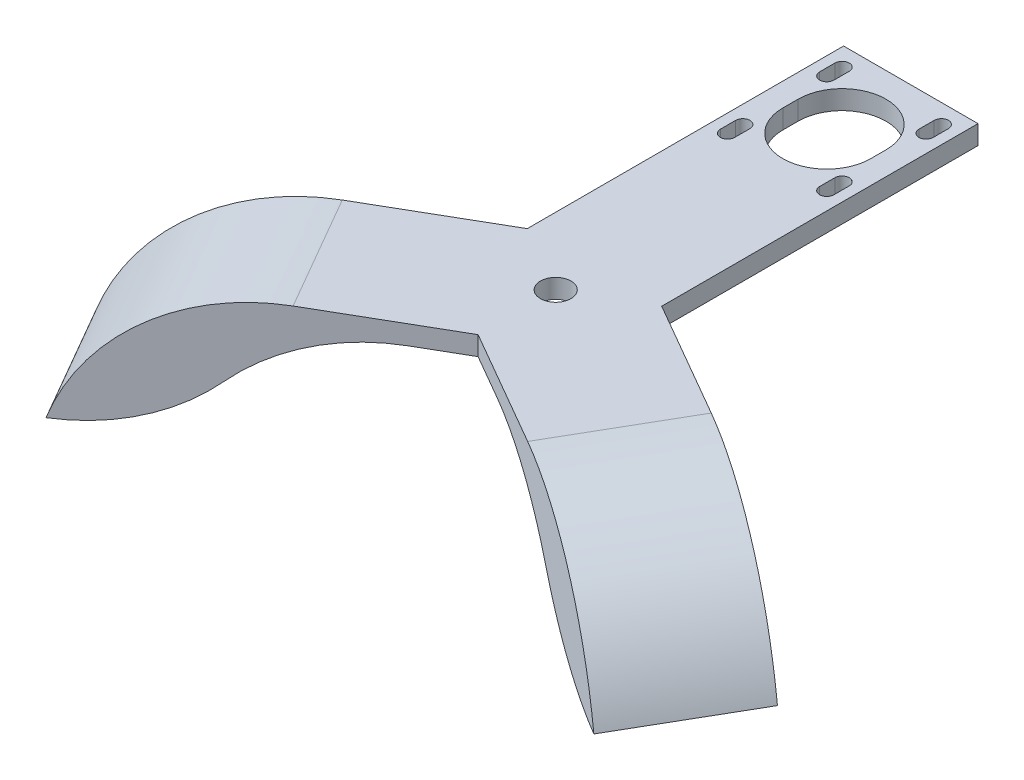
from build123d import *

# Parameters (mm, degrees)
SKETCH1_R           = 4
BOSS_EXTRUDE1_DEPTH = 5
BOSS_EXTRUDE2_DEPTH = 29
FILLET1_R           = 50
FILLET2_R           = 50


with BuildPart() as part:
    # Sketch1 → Boss-Extrude1 (new body)
    with BuildSketch(Plane(origin=(0, 0, 0), x_dir=(1, 0, 0), z_dir=(0, 1, 0))):
        Polygon((-17.6, 10.161364738), (-17.6, 93), (17.6, 93), (17.6, 10.161364738), (89.340362552, -31.257952893), (71.740362552, -61.742047107), (0, -20.322729475), (-71.740362552, -61.742047107), (-89.340362552, -31.257952893), align=None)
        with Locations(Location((0, 0, 0), (0, 0, 270))):
            Circle(SKETCH1_R, mode=Mode.SUBTRACT)
        with BuildLine():
            Line((-11.5, 75), (-11.5, 71))
            ThreePointArc((-11.5, 71), (0, 59.5), (11.5, 71))
            Line((11.5, 71), (11.5, 75))
            ThreePointArc((11.5, 75), (0, 86.5), (-11.5, 75))
        make_face(mode=Mode.SUBTRACT)
        with BuildLine():
            Line((-14.875, 88), (-14.875, 84))
            ThreePointArc((-14.875, 84), (-13, 82.125), (-11.125, 84))
            Line((-11.125, 84), (-11.125, 88))
            ThreePointArc((-11.125, 88), (-13, 89.875), (-14.875, 88))
        make_face(mode=Mode.SUBTRACT)
        with BuildLine():
            Line((11.125, 88), (11.125, 84))
            ThreePointArc((11.125, 84), (13, 82.125), (14.875, 84))
            Line((14.875, 84), (14.875, 88))
            ThreePointArc((14.875, 88), (13, 89.875), (11.125, 88))
        make_face(mode=Mode.SUBTRACT)
        with BuildLine():
            Line((11.125, 62), (11.125, 58))
            ThreePointArc((11.125, 58), (13, 56.125), (14.875, 58))
            Line((14.875, 58), (14.875, 62))
            ThreePointArc((14.875, 62), (13, 63.875), (11.125, 62))
        make_face(mode=Mode.SUBTRACT)
        with BuildLine():
            Line((-14.875, 62), (-14.875, 58))
            ThreePointArc((-14.875, 58), (-13, 56.125), (-11.125, 58))
            Line((-11.125, 58), (-11.125, 62))
            ThreePointArc((-11.125, 62), (-13, 63.875), (-14.875, 62))
        make_face(mode=Mode.SUBTRACT)
    extrude(amount=BOSS_EXTRUDE1_DEPTH)

    # Sketch2 → Boss-Extrude2 (add)
    with BuildSketch(Plane.XZ):
        Polygon((-71.740362552, 61.742047107), (-89.340362552, 31.257952893), (-68.555752861, 19.257952893), (-50.955752861, 49.742047107), align=None)
        Polygon((71.740362552, 61.742047107), (89.340362552, 31.257952893), (68.555752861, 19.257952893), (50.955752861, 49.742047107), align=None)
    extrude(amount=BOSS_EXTRUDE2_DEPTH)

    # Fillet1
    # the kernel refuses this fillet: 50 mm, written as the material it adds along each edge
    with BuildSketch(Plane(origin=(-68.555752861, 0, 19.257952893), x_dir=(0, -1, 0), z_dir=(0.4999999999999999, 0, 0.8660254037844387))) as fillet1_piece_1:
        with BuildLine():
            CenterArc((50, 45.376205218), FILLET1_R, 180, 65.16541251)
            Line((0, 45.376205218), (-1, 45.376205218))
            Line((-1, 45.376205218), (-1, 0))
            Line((-1, 0), (0, -1))
            ThreePointArc((0, -1), (14.5, -1), (28.58, -0.907524104))
            Line((28.58, -0.907524104), (29, 0))
        make_face()
    extrude(amount=35.2)
    with BuildSketch(Plane(origin=(68.555752861, 0, 19.257952893), x_dir=(0, -1, 0), z_dir=(-0.49999999999999983, 0, 0.8660254037844388))) as fillet1_piece_2:
        with BuildLine():
            CenterArc((50, -45.376205218), FILLET1_R, 114.83458749, 65.16541251)
            Line((0, -45.376205218), (-1, -45.376205218))
            Line((-1, -45.376205218), (-1, 0))
            Line((-1, 0), (0, 1))
            ThreePointArc((0, 1), (14.5, 1), (28.58, 0.907524104))
            Line((28.58, 0.907524104), (29, 0))
        make_face()
    extrude(amount=35.2)
    # the kernel refuses this fillet: 50 mm, written as the material it takes off along each edge
    with BuildSketch(Plane(origin=(148.553958964, 5, -71.30300459), x_dir=(-0.8660254037844363, 0, -0.5000000000000039), z_dir=(-0.5000000000000039, 0, 0.8660254037844364)), Plane(origin=(-12.52676614, 5, 164.30300459), x_dir=(0.8660254037844429, 0, -0.4999999999999925), z_dir=(-0.49999999999999256, 0, -0.866025403784443))) as fillet1_2_piece_1:
        with BuildLine():
            CenterArc((47.370877129, 50), FILLET1_R, 198.662924885, 71.337075115)
            Line((0, 34), (-0.947417543, 33.68))
            ThreePointArc((-0.947417543, 33.68), (-1, 17), (-1, 0))
            Line((-1, 0), (0, -1))
            Line((0, -1), (47.370877129, -1))
            Line((47.370877129, -1), (47.370877129, 0))
        make_face()
    extrude(amount=272.054385647, mode=Mode.SUBTRACT)

    # Fillet2
    # the kernel refuses this fillet: 50 mm, written as the material it takes off along each edge
    with BuildSketch(Plane(origin=(-98.555752861, -29, -32.703571334), x_dir=(0.49710588531055566, 0.8188493868753551, -0.2870042166997965), z_dir=(0.4999999999999999, 0, 0.8660254037844387))) as fillet2_piece_1:
        with BuildLine():
            CenterArc((26.55146204, 49.210454923), FILLET2_R, 216.239467537, 43.564898237)
            Line((-13.776202402, 19.652385285), (-14.58275569, 19.061223892))
            ThreePointArc((-14.58275569, 19.061223892), (-7.706950588, 9.252184209), (-0.818849387, -0.574008433))
            Line((-0.818849387, -0.574008433), (0.177009747, -0.984209098))
            ThreePointArc((0.177009747, -0.984209098), (8.850487347, -0.210454923), (17.523964946, -0.984209098))
            Line((17.523964946, -0.984209098), (17.700974693, 0))
        make_face()
    extrude(amount=155.2, mode=Mode.SUBTRACT)
    with BuildSketch(Plane(origin=(98.555752861, -29, -32.703571334), x_dir=(-0.4971058853105562, 0.8188493868753546, -0.2870042166997967), z_dir=(-0.49999999999999983, 0, 0.8660254037844388))) as fillet2_piece_2:
        with BuildLine():
            CenterArc((26.55146204, -49.210454923), FILLET2_R, 100.195634226, 43.564898237)
            Line((-13.776202402, -19.652385285), (-14.58275569, -19.061223892))
            ThreePointArc((-14.58275569, -19.061223892), (-7.706950588, -9.252184209), (-0.818849387, 0.574008433))
            Line((-0.818849387, 0.574008433), (0.177009747, 0.984209098))
            ThreePointArc((0.177009747, 0.984209098), (8.850487347, 0.210454923), (17.523964946, 0.984209098))
            Line((17.523964946, 0.984209098), (17.700974693, 0))
        make_face()
    extrude(amount=155.2, mode=Mode.SUBTRACT)


solid = part.part
